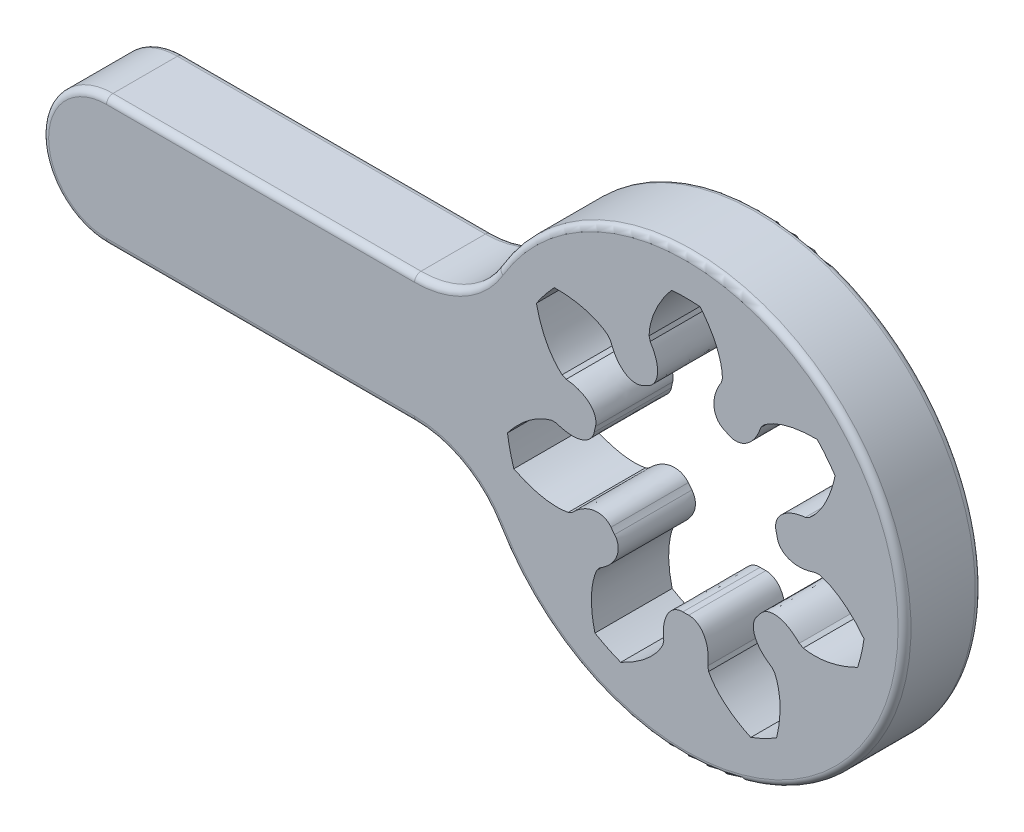
from build123d import *

# Parameters (mm, degrees)
TOOTH_DEPTH         = 9
TEETH_COUNT         = 7
SKETCH6_OUTSIDE_W   = 38.15
SKETCH6_OUTSIDE_H   = 37.445
SKETCH6_OUTSIDE_R   = 13.5
ADDENDUM_DEPTH      = 23.04567102
SKETCH7_R           = 3
CUT_EXTRUDE1_DEPTH  = 21.995911195
BOSS_EXTRUDE1_DEPTH = 6
FILLET1_R           = 0.5


with BuildPart() as part:
    # Sketch1 (on Front Plane) → Tooth (new body)
    with BuildSketch(Plane.XY):
        with BuildLine():
            Line((2.346960508, 10.068100458), (2.29801525, 9.874556228))
            add(Edge.make_bspline(
                [(2.29801525, 9.874556228), (2.141729813, 9.624281829), (1.943671716, 9.235395545), (1.772913442, 8.6922659), (1.698551835, 8.292961838), (1.679163452, 7.893080993), (1.72211669, 7.493308222), (1.839150835, 7.098097635), (2.118646485, 6.584898049), (2.469849808, 6.28768346), (2.748215907, 6.165209593)],
                knots=[0, 0, 0, 0, 0.209034651, 0.307153848, 0.40231646, 0.49590801, 0.589696988, 0.685745971, 0.785979119, 1, 1, 1, 1], degree=3))
            ThreePointArc((2.748215907, 6.165209593), (0, -6.75), (-2.748215907, 6.165209593))
            add(Edge.make_bspline(
                [(-2.29801525, 9.874556228), (-2.141729813, 9.624281829), (-1.943671716, 9.235395545), (-1.772913442, 8.6922659), (-1.698551835, 8.292961838), (-1.679163452, 7.893080993), (-1.72211669, 7.493308222), (-1.839150835, 7.098097635), (-2.118646485, 6.584898049), (-2.469849808, 6.28768346), (-2.748215907, 6.165209593)],
                knots=[0, 0, 0, 0, 0.209034651, 0.307153848, 0.40231646, 0.49590801, 0.589696988, 0.685745971, 0.785979119, 1, 1, 1, 1], degree=3))
            Line((-2.29801525, 9.874556228), (-2.346960508, 10.068100458))
            add(Edge.make_bspline(
                [(0, 14.409950482), (-0.356911361, 14.066753377), (-0.836316537, 13.535647051), (-1.361493729, 12.790278463), (-1.665410481, 12.279464), (-1.902660306, 11.800219844), (-2.080074346, 11.359473165), (-2.205165261, 10.963263683), (-2.303791413, 10.539921887), (-2.34083313, 10.245547654), (-2.346960508, 10.068100458)],
                knots=[0, 0, 0, 0, 0.294485002, 0.424011562, 0.541727497, 0.647632805, 0.741727488, 0.824011547, 0.894484984, 1, 1, 1, 1], degree=3))
            add(Edge.make_bspline(
                [(0, 14.409950482), (0.356911361, 14.066753377), (0.836316537, 13.535647051), (1.361493729, 12.790278463), (1.665410481, 12.279464), (1.902660306, 11.800219844), (2.080074346, 11.359473165), (2.205165261, 10.963263683), (2.303791413, 10.539921887), (2.34083313, 10.245547654), (2.346960508, 10.068100458)],
                knots=[0, 0, 0, 0, 0.294485002, 0.424011562, 0.541727497, 0.647632805, 0.741727488, 0.824011547, 0.894484984, 1, 1, 1, 1], degree=3))
        make_face()
    tooth = extrude(amount=TOOTH_DEPTH)

    # Teeth: Tooth ×7 about axis
    teeth_axis = Axis((0, 0, 9), (0, 0, -1))
    for i in range(1, TEETH_COUNT):
        add(tooth.rotate(teeth_axis, i * 360 / TEETH_COUNT))

    # Sketch6 outside → Addendum (cut, through all)
    with BuildSketch(Plane.XY):
        with Locations((0, 0.7135)):
            Rectangle(SKETCH6_OUTSIDE_W, SKETCH6_OUTSIDE_H)
        Circle(SKETCH6_OUTSIDE_R, mode=Mode.SUBTRACT)
    extrude(amount=ADDENDUM_DEPTH, mode=Mode.SUBTRACT)

    # Sketch7 → Cut-Extrude1 (cut, through all)
    with BuildSketch(Plane.XY.offset(9)):
        with Locations((0.017320508, 0.01)):
            Circle(SKETCH7_R)
    extrude(amount=-CUT_EXTRUDE1_DEPTH, mode=Mode.SUBTRACT)


with BuildPart() as body_2:
    # Boss-Extrude1: read off the stored shape, not the designer's step
    # Boss-Extrude1 outline → Boss-Extrude1 (new body)
    with BuildSketch(Plane(origin=(0, 0, 0), x_dir=(-1, 0, 0), z_dir=(0, 0, -1))):
        with BuildLine():
            ThreePointArc((14.620907249, 8.673469388), (-17, 0), (14.620907249, -8.673469388))
            ThreePointArc((14.620907249, -8.673469388), (17.359770061, -5.982754432), (21.071307506, -5))
            Line((21.071307506, -5), (45, -5))
            ThreePointArc((45, -5), (50, 0), (45, 5))
            Line((45, 5), (21.071307506, 5))
            ThreePointArc((21.071307506, 5), (17.359770061, 5.982754432), (14.620907249, 8.673469388))
        make_face()
        with BuildLine():
            add(Edge.make_bspline(
                [(9.129303848, -5.006088074), (9.219666654, -5.023455622), (9.310043813, -5.040108505), (9.490980423, -5.064337987), (9.581515528, -5.073126751), (9.853290398, -5.091050912), (10.034694213, -5.092018277), (10.579438622, -5.068384018), (10.944801822, -5.016749769), (11.658430249, -4.860754208), (12.010275416, -4.755629351), (12.525111948, -4.565580963), (12.694484619, -4.496864893), (13.029056287, -4.34943123), (13.193617944, -4.269186358), (13.358431918, -4.189546121)],
                knots=[0, 0, 0, 0, 0.0625, 0.0625, 0.125, 0.125, 0.25, 0.25, 0.5, 0.5, 0.75, 0.75, 0.875, 0.875, 1, 1, 1, 1], degree=3))
            Line((9.129303848, -5.006088074), (8.818549377, -4.847415278))
            add(Edge.make_bspline(
                [(5.805479631, -4.342675137), (5.981317985, -4.109799927), (6.243608365, -3.957196739), (6.66730345, -3.862353666), (6.812429459, -3.852467627), (7.10102634, -3.868120176), (7.24202385, -3.893184233), (7.518899084, -3.970048373), (7.654924711, -4.022302631), (7.91348979, -4.145077325), (8.037433863, -4.215966075), (8.2765204, -4.373408684), (8.39207112, -4.460400955), (8.612483608, -4.645905199), (8.716324252, -4.745759067), (8.818549377, -4.847415278)],
                knots=[3e-09, 3e-09, 3e-09, 3e-09, 0.25, 0.25, 0.375, 0.375, 0.5, 0.5, 0.625, 0.625, 0.75, 0.75, 0.875, 0.875, 1, 1, 1, 1], degree=3))
            ThreePointArc((5.805479631, -4.342675137), (5.667522306, -4.521244458), (5.524072467, -4.69543224))
            add(Edge.make_bspline(
                [(6.6881923, -7.518798558), (6.566659736, -7.441960959), (6.446777987, -7.363290467), (6.219592148, -7.191984571), (6.111073665, -7.100697503), (5.905822665, -6.905037465), (5.809047405, -6.800711954), (5.630274485, -6.575653436), (5.548231537, -6.454364939), (5.410283998, -6.201160409), (5.35290752, -6.06660316), (5.272706323, -5.788968179), (5.249880367, -5.647572911), (5.245937272, -5.213757022), (5.335782293, -4.920174033), (5.524072467, -4.69543224)],
                knots=[0, 0, 0, 0, 0.125, 0.125, 0.25, 0.25, 0.375, 0.375, 0.5, 0.5, 0.625, 0.625, 0.75, 0.75, 1, 1, 1, 1], degree=3))
            Line((6.6881923, -7.518798558), (6.912036213, -7.786453747))
            add(Edge.make_bspline(
                [(7.057036199, -12.091246424), (7.097957744, -11.91304941), (7.139526933, -11.734975987), (7.208798325, -11.376182902), (7.238123382, -11.195736715), (7.308902828, -10.651338339), (7.333077445, -10.28672365), (7.326495257, -9.554713385), (7.296113063, -9.19058047), (7.197406294, -8.650403277), (7.155872579, -8.472939946), (7.077734207, -8.211507841), (7.048983218, -8.125177238), (6.985149153, -7.954420277), (6.948922668, -7.870337776), (6.912036213, -7.786453747)],
                knots=[0, 0, 0, 0, 0.125, 0.125, 0.25, 0.25, 0.5, 0.5, 0.75, 0.75, 0.875, 0.875, 0.9375, 0.9375, 1, 1, 1, 1], degree=3))
            ThreePointArc((7.057036199, -12.091246424), (6.074372348, -12.613564151), (5.053327015, -13.05618191))
            add(Edge.make_bspline(
                [(1.778110587, -10.258822023), (1.820872379, -10.340298998), (1.864201868, -10.421341609), (1.958070628, -10.577910382), (2.00764701, -10.654173282), (2.163082196, -10.877830964), (2.275429308, -11.020261319), (2.6335499, -11.431423929), (2.90171941, -11.684882954), (3.468621697, -12.145558483), (3.770183494, -12.355097835), (4.239764634, -12.639120012), (4.399091154, -12.72869713), (4.722961456, -12.898352408), (4.888301938, -12.976980033), (5.053327015, -13.05618191)],
                knots=[0, 0, 0, 0, 0.0625, 0.0625, 0.125, 0.125, 0.25, 0.25, 0.5, 0.5, 0.75, 0.75, 0.875, 0.875, 1, 1, 1, 1], degree=3))
            Line((1.778110587, -10.258822023), (1.708413731, -9.916933524))
            add(Edge.make_bspline(
                [(0.224417204, -7.246520406), (0.516119796, -7.238801049), (0.798965149, -7.348721394), (1.137286014, -7.620845862), (1.235499818, -7.728146101), (1.403199374, -7.963539433), (1.471514015, -8.089402909), (1.584048095, -8.353796691), (1.628004662, -8.492725806), (1.693228231, -8.771428894), (1.715083041, -8.912530685), (1.741057469, -9.197619928), (1.745088869, -9.342199912), (1.737480749, -9.630185339), (1.724155434, -9.773629092), (1.708413731, -9.916933524)],
                knots=[3e-09, 3e-09, 3e-09, 3e-09, 0.25, 0.25, 0.375, 0.375, 0.5, 0.5, 0.625, 0.625, 0.75, 0.75, 0.875, 0.875, 1, 1, 1, 1], degree=3))
            ThreePointArc((0.224417204, -7.246520406), (-0.001208898, -7.249997178), (-0.226833901, -7.246447883))
            add(Edge.make_bspline(
                [(-1.708413731, -9.916933524), (-1.724113992, -9.77400808), (-1.737351972, -9.631230505), (-1.745067683, -9.346801985), (-1.741356746, -9.205042262), (-1.716355474, -8.92257853), (-1.695128893, -8.781870693), (-1.630634151, -8.501778705), (-1.586959927, -8.362012805), (-1.475005537, -8.096290633), (-1.405578093, -7.967536824), (-1.238518953, -7.731730424), (-1.142203432, -7.625725866), (-0.805490991, -7.352163247), (-0.519941113, -7.239360913), (-0.226833901, -7.246447883)],
                knots=[0, 0, 0, 0, 0.125, 0.125, 0.25, 0.25, 0.375, 0.375, 0.5, 0.5, 0.625, 0.625, 0.75, 0.75, 1, 1, 1, 1], degree=3))
            Line((-1.708413731, -9.916933524), (-1.778110587, -10.258822023))
            add(Edge.make_bspline(
                [(-5.053327015, -13.05618191), (-4.888492814, -12.977071642), (-4.723351439, -12.898544779), (-4.399645704, -12.728999505), (-4.240283319, -12.6394204), (-3.770525268, -12.355331164), (-3.470385397, -12.1468981), (-2.902180654, -11.685351003), (-2.636433065, -11.434564088), (-2.275648194, -11.020597058), (-2.162797623, -10.877478115), (-2.00712025, -10.653386824), (-1.957550216, -10.577082146), (-1.863846936, -10.42070944), (-1.820695434, -10.339961851), (-1.778110587, -10.258822023)],
                knots=[0, 0, 0, 0, 0.125, 0.125, 0.25, 0.25, 0.5, 0.5, 0.75, 0.75, 0.875, 0.875, 0.9375, 0.9375, 1, 1, 1, 1], degree=3))
            ThreePointArc((-5.053327015, -13.05618191), (-6.074372348, -12.613564151), (-7.057036199, -12.091246424))
            add(Edge.make_bspline(
                [(-6.912036213, -7.786453747), (-6.949075936, -7.870686325), (-6.985422107, -7.955091925), (-7.049306288, -8.12610051), (-7.078020655, -8.212410027), (-7.155971018, -8.473382432), (-7.197280276, -8.650022816), (-7.295455612, -9.186368463), (-7.326416902, -9.554060946), (-7.33312974, -10.284509496), (-7.308933497, -10.650925651), (-7.238211924, -11.195143901), (-7.208907675, -11.37556081), (-7.139619682, -11.734551144), (-7.09800513, -11.912843061), (-7.057036199, -12.091246424)],
                knots=[0, 0, 0, 0, 0.0625, 0.0625, 0.125, 0.125, 0.25, 0.25, 0.5, 0.5, 0.75, 0.75, 0.875, 0.875, 1, 1, 1, 1], degree=3))
            Line((-6.912036213, -7.786453747), (-6.6881923, -7.518798558))
            add(Edge.make_bspline(
                [(-5.525635954, -4.693588008), (-5.337727126, -4.916837337), (-5.247315119, -5.206508954), (-5.249130986, -5.640685687), (-5.271786386, -5.784372935), (-5.351265341, -6.06225107), (-5.407075887, -6.194136201), (-5.543623418, -6.446965714), (-5.624836103, -6.567953228), (-5.802068721, -6.792715601), (-5.898760293, -6.897777907), (-6.105457247, -7.095835768), (-6.215980894, -7.18913179), (-6.445880552, -7.362739499), (-6.566337592, -7.441757065), (-6.6881923, -7.518798558)],
                knots=[3e-09, 3e-09, 3e-09, 3e-09, 0.25, 0.25, 0.375, 0.375, 0.5, 0.5, 0.625, 0.625, 0.75, 0.75, 0.875, 0.875, 1, 1, 1, 1], degree=3))
            ThreePointArc((-5.525635954, -4.693588008), (-5.669029777, -4.51935415), (-5.806929715, -4.34074047))
            add(Edge.make_bspline(
                [(-8.818549377, -4.847415278), (-8.716594718, -4.746027763), (-8.613220461, -4.646657531), (-8.395655956, -4.463286864), (-8.282510011, -4.377802449), (-8.046082934, -4.221235975), (-7.92283856, -4.150101683), (-7.663642012, -4.025891205), (-7.527138198, -3.972894474), (-7.249585818, -3.894748877), (-7.105634733, -3.868752751), (-6.817114196, -3.852341961), (-6.67418475, -3.861551707), (-6.250368109, -3.95424059), (-5.984138256, -4.10716137), (-5.806929715, -4.34074047)],
                knots=[0, 0, 0, 0, 0.125, 0.125, 0.25, 0.25, 0.375, 0.375, 0.5, 0.5, 0.625, 0.625, 0.75, 0.75, 1, 1, 1, 1], degree=3))
            Line((-8.818549377, -4.847415278), (-9.129303848, -5.006088074))
            add(Edge.make_bspline(
                [(-13.358431918, -4.189546121), (-13.193808576, -4.269094243), (-13.029449839, -4.349246271), (-12.695066781, -4.496619856), (-12.525670196, -4.565362727), (-12.010670932, -4.755507619), (-11.660577253, -4.86021053), (-10.945455339, -5.016680978), (-10.583691322, -5.068087726), (-10.035093177, -5.092056475), (-9.852837101, -5.091053403), (-9.580572221, -5.07304824), (-9.49000841, -5.064228464), (-9.309328267, -5.039991851), (-9.219292738, -5.023383756), (-9.129303848, -5.006088074)],
                knots=[0, 0, 0, 0, 0.125, 0.125, 0.25, 0.25, 0.5, 0.5, 0.75, 0.75, 0.875, 0.875, 0.9375, 0.9375, 1, 1, 1, 1], degree=3))
            ThreePointArc((-13.358431918, -4.189546121), (-13.648990771, -3.115293076), (-13.853307218, -2.021355764))
            add(Edge.make_bspline(
                [(-10.397278764, 0.549273015), (-10.486228336, 0.525713683), (-10.574880758, 0.501504233), (-10.748411789, 0.444828789), (-10.833794402, 0.413465481), (-11.086432101, 0.311695896), (-11.250291015, 0.233859296), (-11.730834248, -0.023790177), (-12.037611856, -0.228836178), (-12.612884914, -0.679015092), (-12.884274489, -0.926389213), (-13.265667271, -1.320996093), (-13.38845199, -1.456395181), (-13.625921578, -1.734393528), (-13.739369563, -1.878092286), (-13.853307218, -2.021355764)],
                knots=[0, 0, 0, 0, 0.0625, 0.0625, 0.125, 0.125, 0.25, 0.25, 0.5, 0.5, 0.75, 0.75, 0.875, 0.875, 1, 1, 1, 1], degree=3))
            Line((-10.397278764, 0.549273015), (-10.048453115, 0.541145078))
            add(Edge.make_bspline(
                [(-7.114772536, 1.393711892), (-7.172156652, 1.107605175), (-7.342260078, 0.856310923), (-7.682845291, 0.587025859), (-7.809309917, 0.51515103), (-8.076118108, 0.404035996), (-8.214027362, 0.365441404), (-8.496833428, 0.314561939), (-8.642060556, 0.302622092), (-8.928289586, 0.301051085), (-9.070716813, 0.311142324), (-9.354438127, 0.349257453), (-9.496290261, 0.377499202), (-9.775362325, 0.448999357), (-9.912244482, 0.493909816), (-10.048453115, 0.541145078)],
                knots=[3e-09, 3e-09, 3e-09, 3e-09, 0.25, 0.25, 0.375, 0.375, 0.5, 0.5, 0.625, 0.625, 0.75, 0.75, 0.875, 0.875, 1, 1, 1, 1], degree=3))
            ThreePointArc((-7.114772536, 1.393711892), (-7.067955607, 1.614454731), (-7.014289014, 1.833633052))
            add(Edge.make_bspline(
                [(-9.288137477, 3.872305541), (-9.145301835, 3.855808261), (-9.003158264, 3.836943338), (-8.724144054, 3.7811743), (-8.586764304, 3.746011898), (-8.316945835, 3.658783367), (-8.184489195, 3.606778541), (-7.925771129, 3.481574486), (-7.79922788, 3.407894427), (-7.565080114, 3.239618222), (-7.455003491, 3.143281051), (-7.262283405, 2.927938572), (-7.180368823, 2.810449649), (-6.988590557, 2.421305883), (-6.942157238, 2.117814456), (-7.014289014, 1.833633052)],
                knots=[0, 0, 0, 0, 0.125, 0.125, 0.25, 0.25, 0.375, 0.375, 0.5, 0.5, 0.625, 0.625, 0.75, 0.75, 1, 1, 1, 1], degree=3))
            Line((-9.288137477, 3.872305541), (-9.605945107, 4.0163323))
            add(Edge.make_bspline(
                [(-11.604365124, 7.831903349), (-11.563917375, 7.653598194), (-11.524106758, 7.475123388), (-11.43084364, 7.121806258), (-11.378971938, 6.946506196), (-11.206536412, 6.425310157), (-11.070116605, 6.0863147), (-10.746578907, 5.429652145), (-10.561214145, 5.114762064), (-10.237908319, 4.670906493), (-10.123489281, 4.52903836), (-9.939657902, 4.327399141), (-9.876296711, 4.262092542), (-9.744695537, 4.135942399), (-9.675574571, 4.075904766), (-9.605945107, 4.0163323)],
                knots=[0, 0, 0, 0, 0.125, 0.125, 0.25, 0.25, 0.5, 0.5, 0.75, 0.75, 0.875, 0.875, 0.9375, 0.9375, 1, 1, 1, 1], degree=3))
            ThreePointArc((-11.604365124, 7.831903349), (-10.945640755, 8.728857226), (-10.217755346, 9.570657015))
            add(Edge.make_bspline(
                [(-6.053158341, 8.471385994), (-6.127036919, 8.526240566), (-6.201238511, 8.580457475), (-6.353743985, 8.680792937), (-6.431499995, 8.727993049), (-6.66858369, 8.862060857), (-6.831603155, 8.941640589), (-7.33265543, 9.156702598), (-7.684239559, 9.268706899), (-8.394880492, 9.437791525), (-8.757494, 9.495737198), (-9.303804592, 9.547888716), (-9.486218882, 9.559465724), (-9.851626607, 9.57179779), (-10.034708483, 9.570900286), (-10.217755346, 9.570657015)],
                knots=[0, 0, 0, 0, 0.0625, 0.0625, 0.125, 0.125, 0.25, 0.25, 0.5, 0.5, 0.75, 0.75, 0.875, 0.875, 1, 1, 1, 1], degree=3))
            Line((-6.053158341, 8.471385994), (-5.842023783, 8.193595433))
            add(Edge.make_bspline(
                [(-3.346340284, 6.431518311), (-3.605805934, 6.297998399), (-3.908333443, 6.274311209), (-4.33122039, 6.372694961), (-4.466263799, 6.426755763), (-4.719489217, 6.566075716), (-4.835648697, 6.649834178), (-5.051754563, 6.839218037), (-5.151637145, 6.945316804), (-5.331326288, 7.168120164), (-5.412238564, 7.285766039), (-5.559336302, 7.531352689), (-5.625699372, 7.659865595), (-5.743796887, 7.922632538), (-5.794029104, 8.057652532), (-5.842023783, 8.193595433)],
                knots=[3e-09, 3e-09, 3e-09, 3e-09, 0.25, 0.25, 0.375, 0.375, 0.5, 0.5, 0.625, 0.625, 0.75, 0.75, 0.875, 0.875, 1, 1, 1, 1], degree=3))
            ThreePointArc((-3.346340284, 6.431518311), (-3.144566705, 6.532546271), (-2.93974562, 6.627243487))
            add(Edge.make_bspline(
                [(-2.763568613, 9.676101308), (-2.687410141, 9.55414202), (-2.613534264, 9.431247614), (-2.483173739, 9.178334094), (-2.425009939, 9.049002882), (-2.324978887, 8.783664208), (-2.283052533, 8.647680959), (-2.219632929, 8.367343578), (-2.198339893, 8.222469317), (-2.183914784, 7.934486724), (-2.190602565, 7.788360111), (-2.238805087, 7.503421641), (-2.279588719, 7.366125096), (-2.464261774, 6.97355964), (-2.672590226, 6.7480328), (-2.93974562, 6.627243487)],
                knots=[0, 0, 0, 0, 0.125, 0.125, 0.25, 0.25, 0.375, 0.375, 0.5, 0.5, 0.625, 0.625, 0.75, 0.75, 1, 1, 1, 1], degree=3))
            Line((-2.763568613, 9.676101308), (-2.849113775, 10.014372534))
            add(Edge.make_bspline(
                [(-1.111974706, 13.955769855), (-1.226160531, 13.812975086), (-1.340876239, 13.670572671), (-1.558962092, 13.377367002), (-1.663675722, 13.22751427), (-1.963651401, 12.767738333), (-2.143632364, 12.449720822), (-2.455309367, 11.787346458), (-2.585927308, 11.446091698), (-2.731369682, 10.916581602), (-2.770947551, 10.738671862), (-2.81397845, 10.469226706), (-2.825532149, 10.378970933), (-2.842108312, 10.197427665), (-2.845951407, 10.105953866), (-2.849113775, 10.014372534)],
                knots=[0, 0, 0, 0, 0.125, 0.125, 0.25, 0.25, 0.5, 0.5, 0.75, 0.75, 0.875, 0.875, 0.9375, 0.9375, 1, 1, 1, 1], degree=3))
            ThreePointArc((-1.111974706, 13.955769855), (0, 14), (1.111974706, 13.955769855))
            add(Edge.make_bspline(
                [(2.849113775, 10.014372534), (2.845938267, 10.106334398), (2.842062818, 10.198151229), (2.825422632, 10.379942947), (2.813845087, 10.470163832), (2.770844254, 10.73911324), (2.73142122, 10.916184141), (2.587162486, 11.442011554), (2.455521855, 11.786724634), (2.144640165, 12.447748628), (1.963858091, 12.767379821), (1.664012708, 13.227018581), (1.559330528, 13.376853961), (1.341144135, 13.670230143), (1.226292756, 13.812809732), (1.111974706, 13.955769855)],
                knots=[0, 0, 0, 0, 0.0625, 0.0625, 0.125, 0.125, 0.25, 0.25, 0.5, 0.5, 0.75, 0.75, 0.875, 0.875, 1, 1, 1, 1], degree=3))
            Line((2.849113775, 10.014372534), (2.763568613, 9.676101308))
            add(Edge.make_bspline(
                [(2.941954455, 6.626260263), (2.675790198, 6.745870373), (2.46864799, 6.967627182), (2.281901805, 7.359594777), (2.239970055, 7.498882324), (2.191011314, 7.783726498), (2.184072065, 7.926766184), (2.197398525, 8.213803458), (2.21807411, 8.358046305), (2.280234443, 8.637448556), (2.321765713, 8.774059324), (2.422059149, 9.042185739), (2.481157887, 9.174196962), (2.61296476, 9.430361827), (2.687208366, 9.553818544), (2.763568613, 9.676101308)],
                knots=[3e-09, 3e-09, 3e-09, 3e-09, 0.25, 0.25, 0.375, 0.375, 0.5, 0.5, 0.625, 0.625, 0.75, 0.75, 0.875, 0.875, 1, 1, 1, 1], degree=3))
            ThreePointArc((2.941954455, 6.626260263), (3.146745064, 6.531497229), (3.348486186, 6.430404404))
            add(Edge.make_bspline(
                [(5.842023783, 8.193595433), (5.794156203, 8.058011969), (5.744134343, 7.923630075), (5.627677049, 7.664021112), (5.562826372, 7.537910129), (5.417744584, 7.294266747), (5.337569252, 7.176703234), (5.157934139, 6.952332293), (5.057942871, 6.845357103), (4.841782922, 6.654524888), (4.723366772, 6.568645153), (4.470539125, 6.428675173), (4.337768185, 6.374958104), (3.915706387, 6.274580754), (3.609491738, 6.296844812), (3.348486186, 6.430404404)],
                knots=[0, 0, 0, 0, 0.125, 0.125, 0.25, 0.25, 0.375, 0.375, 0.5, 0.5, 0.625, 0.625, 0.75, 0.75, 1, 1, 1, 1], degree=3))
            Line((5.842023783, 8.193595433), (6.053158341, 8.471385994))
            add(Edge.make_bspline(
                [(10.217755346, 9.570657015), (10.034920203, 9.570900005), (9.852061437, 9.571801904), (9.486849709, 9.559497545), (9.304402245, 9.547934307), (8.757903165, 9.495799129), (8.397050769, 9.438233237), (7.684858205, 9.26892847), (7.336615536, 9.158280825), (6.831946036, 8.941848108), (6.668174203, 8.861866423), (6.430684169, 8.727513028), (6.352915752, 8.680272519), (6.20064444, 8.580041909), (6.126731214, 8.526013581), (6.053158341, 8.471385994)],
                knots=[0, 0, 0, 0, 0.125, 0.125, 0.25, 0.25, 0.5, 0.5, 0.75, 0.75, 0.875, 0.875, 0.9375, 0.9375, 1, 1, 1, 1], degree=3))
            ThreePointArc((10.217755346, 9.570657015), (10.945640755, 8.728857226), (11.604365124, 7.831903349))
            add(Edge.make_bspline(
                [(9.605945107, 4.0163323), (9.675863891, 4.076152298), (9.745232877, 4.136429103), (9.876988379, 4.262784206), (9.940307426, 4.328087697), (10.12376996, 4.529394315), (10.237629705, 4.670618386), (10.558794281, 5.111252435), (10.746225229, 5.429098314), (11.069203035, 6.084297126), (11.206384985, 6.424925032), (11.378794499, 6.945933672), (11.430672245, 7.121198328), (11.524005989, 7.474700376), (11.563870537, 7.65339172), (11.604365124, 7.831903349)],
                knots=[0, 0, 0, 0, 0.0625, 0.0625, 0.125, 0.125, 0.25, 0.25, 0.5, 0.5, 0.75, 0.75, 0.875, 0.875, 1, 1, 1, 1], degree=3))
            Line((9.605945107, 4.0163323), (9.288137477, 3.872305541))
            add(Edge.make_bspline(
                [(7.014897484, 1.831293086), (6.942461734, 2.113964365), (6.986687135, 2.414177773), (7.176705399, 2.804569618), (7.25946077, 2.924197546), (7.451635638, 3.140072468), (7.559142016, 3.234681577), (7.791865705, 3.403227344), (7.917530321, 3.476996464), (8.174732131, 3.602602014), (8.307433053, 3.65530698), (8.579594659, 3.7440685), (8.719652651, 3.780170897), (9.002110647, 3.836836315), (9.144923127, 3.855764331), (9.288137477, 3.872305541)],
                knots=[3e-09, 3e-09, 3e-09, 3e-09, 0.25, 0.25, 0.375, 0.375, 0.5, 0.5, 0.625, 0.625, 0.75, 0.75, 0.875, 0.875, 1, 1, 1, 1], degree=3))
            ThreePointArc((7.014897484, 1.831293086), (7.068493617, 1.612097555), (7.115239597, 1.391339649))
            add(Edge.make_bspline(
                [(10.048453115, 0.541145078), (9.912604746, 0.494034552), (9.776352631, 0.449357476), (9.500772235, 0.378543915), (9.361740964, 0.350617304), (9.080795881, 0.312137649), (8.938892524, 0.301521596), (8.651471597, 0.30207299), (8.50549149, 0.313551371), (8.221519333, 0.363570084), (8.080544591, 0.40260642), (7.813476194, 0.513005178), (7.688697171, 0.583317635), (7.347067772, 0.850714582), (7.173552803, 1.104004248), (7.115239597, 1.391339649)],
                knots=[0, 0, 0, 0, 0.125, 0.125, 0.25, 0.25, 0.375, 0.375, 0.5, 0.5, 0.625, 0.625, 0.75, 0.75, 1, 1, 1, 1], degree=3))
            Line((10.048453115, 0.541145078), (10.397278764, 0.549273015))
            add(Edge.make_bspline(
                [(13.853307218, -2.021355764), (13.739501349, -1.878257991), (13.626195905, -1.734730926), (13.388870182, -1.456868542), (13.266075546, -1.321434931), (12.88457802, -0.926670497), (12.614583404, -0.68043648), (12.038170806, -0.229181707), (11.734537242, -0.025902304), (11.250667042, 0.233720607), (11.086024775, 0.311894818), (10.832910447, 0.413804031), (10.747488515, 0.445151853), (10.574185459, 0.501709595), (10.485860268, 0.52581117), (10.397278764, 0.549273015)],
                knots=[0, 0, 0, 0, 0.125, 0.125, 0.25, 0.25, 0.5, 0.5, 0.75, 0.75, 0.875, 0.875, 0.9375, 0.9375, 1, 1, 1, 1], degree=3))
            ThreePointArc((13.853307218, -2.021355764), (13.648990771, -3.115293076), (13.358431918, -4.189546121))
        make_face(mode=Mode.SUBTRACT)
    extrude(amount=BOSS_EXTRUDE1_DEPTH)

    # Fillet1
    fillet1_edges = [body_2.edges().sort_by_distance(p)[0] for p in [
        (-50, 0, -6),
        (-33.035653753, 5, -6),
        (-17.359770061, 5.982754432, -6),
        (17, 0, -6),
        (-17.359770061, -5.982754432, -6),
        (-33.035653753, -5, -6),
        (17, 0, 0),
        (-17.359770061, 5.982754432, 0),
        (-33.035653753, 5, 0),
        (-50, 0, 0),
        (-33.035653753, -5, 0),
        (-17.359770061, -5.982754432, 0),
    ]]
    fillet(fillet1_edges, radius=FILLET1_R)


solid = body_2.part
